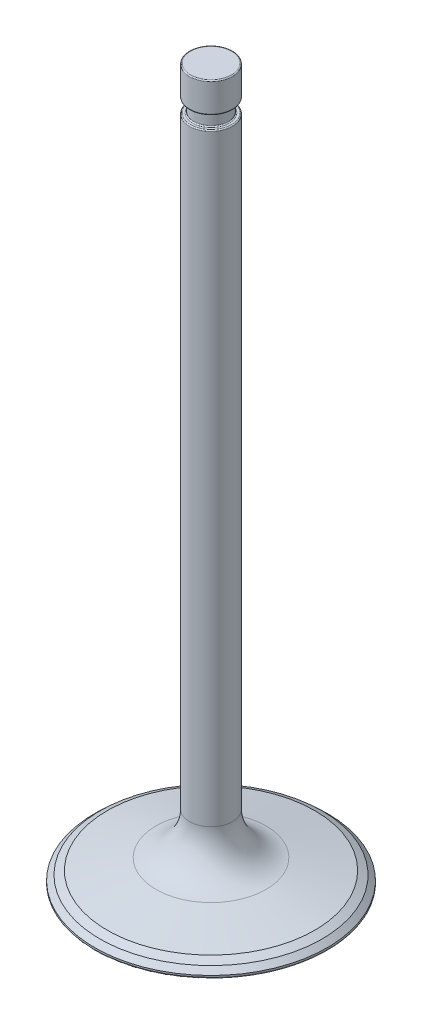
from build123d import *

# Parameters (mm, degrees)
FILLET1_R      = 10
CHAMFER1_SIZE  = 2
CHAMFER1_SIZE2 = 1.36299339
CHAMFER3_SIZE  = 1
CHAMFER3_SIZE2 = 0.999999525
FILLET2_R      = 0.25


with BuildPart() as part:
    # Sketch1 → Revolve1 (revolve)
    with BuildSketch(Plane.XY):
        Polygon((0, 0), (0, 165), (-5, 165), (-5, 158), (-4, 158), (-4, 155), (-5, 155), (-5, 7), (-27, 2), (-27, 0), align=None)
    revolve(axis=Axis((0, 0, 0), (0, 1, 0)))

    # Fillet1
    fillet1_edges = [part.edges().sort_by_distance(p)[0] for p in [
        (5, 7, 0),
    ]]
    fillet(fillet1_edges, radius=FILLET1_R)

    # Chamfer1
    chamfer1_edges = [part.edges().sort_by_distance(p)[0] for p in [
        (27, 2, 0),
    ]]
    chamfer1_side = [part.faces().sort_by_distance(p)[0] for p in [
        (19.891894482, 3.615478527, 0),
    ]]
    chamfer(chamfer1_edges, length=CHAMFER1_SIZE, length2=CHAMFER1_SIZE2, reference=chamfer1_side[0])

    # Chamfer3
    chamfer3_edges = [part.edges().sort_by_distance(p)[0] for p in [
        (25.049727894, 2.443242207, 0),
    ]]
    chamfer3_side = [part.faces().sort_by_distance(p)[0] for p in [
        (18.916761626, 3.83709963, 0),
    ]]
    chamfer(chamfer3_edges, length=CHAMFER3_SIZE, length2=CHAMFER3_SIZE2, reference=chamfer3_side[0])

    # Fillet2
    fillet2_edges = [part.edges().sort_by_distance(p)[0] for p in [
        (4, 158, 0),
        (4, 155, 0),
        (5, 165, 0),
        (5, 158, 0),
        (27, 0, 0),
        (5, 155, 0),
    ]]
    fillet(fillet2_edges, radius=FILLET2_R)


solid = part.part
